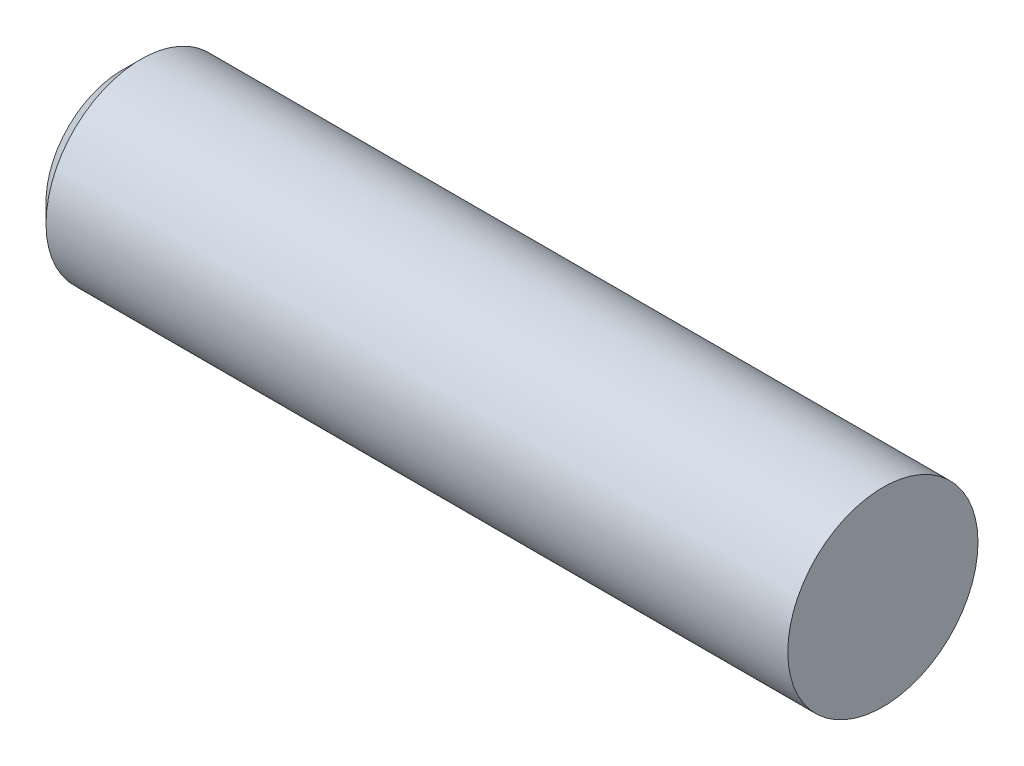
from build123d import *

# Parameters (mm, degrees)
EXTRUDE1_DEPTH        = 6.35
EXTRUDE1_DEPTH_BACK   = 6.35
SKETCH2_R             = 1.5875
CHAMFER1_SIZE         = 0.3175
DELETEFACE1_START     = 6.0324999
DELETEFACE1_OUTLINE_R = 1.5875
DELETEFACE1_DEPTH     = 0.3175001


# Read off the part's stored shape, not the designer's step: DeleteFace1
with BuildPart() as part:
    # Sketch2 → Extrude1 (new, two sides: drawn at the far end of the back side and taken through both)
    with BuildSketch(Plane(origin=(0, 0, 0), x_dir=(0, 0, -1), z_dir=(1, 0, 0)).offset(-EXTRUDE1_DEPTH_BACK)):
        Circle(SKETCH2_R)
    extrude(amount=EXTRUDE1_DEPTH + EXTRUDE1_DEPTH_BACK)

    # Chamfer1
    chamfer1_edges = [part.edges().sort_by_distance(p)[0] for p in [
        (-6.35, 0, 1.5875),
        (6.35, 0, 1.5875),
    ]]
    chamfer(chamfer1_edges, length=CHAMFER1_SIZE)

    # DeleteFace1 outline → DeleteFace1 (add)
    with BuildSketch(Plane.YZ.offset(DELETEFACE1_START)):
        Circle(DELETEFACE1_OUTLINE_R)
    extrude(amount=DELETEFACE1_DEPTH)


solid = part.part
